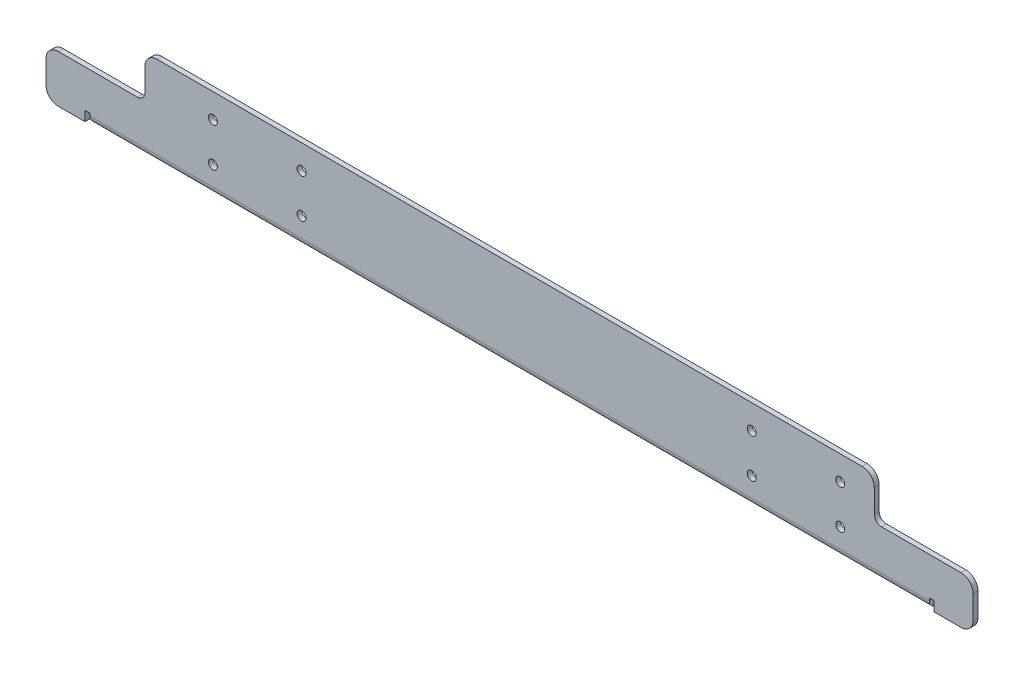
from build123d import *

# Parameters (mm, degrees)
BOSS_EXTRUDE1_START        = 8
SKETCH2_W                  = 381
SKETCH2_H                  = 2
BOSS_EXTRUDE1_DEPTH        = 37
SKETCH3_W                  = 345
SKETCH3_H                  = 2
BOSS_EXTRUDE2_DEPTH        = 6
SKETCH4_W                  = 40.623
SKETCH4_H                  = 17.5
CUT_EXTRUDE1_DEPTH         = 3
F_6_CLEARANCE_HOLE1_D      = 3.6576
FILLET2_R                  = 5
FILLET3_R                  = 3
SKETCH8_W                  = 2
SKETCH8_H                  = 4
CUT_EXTRUDE2_DEPTH         = 196.834751768
FLATTEN_BENDS1_START       = -7
FLATTEN_BENDS1_OUTLINE_W   = 345
FLATTEN_BENDS1_OUTLINE_H   = 2
FLATTEN_BENDS1_DEPTH       = 6
FLATTEN_BENDS1_START_2     = -1
FLATTEN_BENDS1_2_OUTLINE_W = 345
FLATTEN_BENDS1_2_OUTLINE_H = 4.701769682
FLATTEN_BENDS1_2_DEPTH     = 2
PROCESS_BENDS1_START       = -172.5
PROCESS_BENDS1_DEPTH       = 345
PROCESS_BENDS1_2_DEPTH     = 345


# Read off the part's stored shape, not the designer's step: Flatten-Bends1, Process-Bends1
with BuildPart() as part:
    # Sketch2 → Boss-Extrude1 (new body)
    with BuildSketch(Plane(origin=(0, 0, 0), x_dir=(1, 0, 0), z_dir=(0, 1, 0)).offset(BOSS_EXTRUDE1_START)):
        Rectangle(SKETCH2_W, SKETCH2_H)
    extrude(amount=BOSS_EXTRUDE1_DEPTH)

    # Sketch3 → Boss-Extrude2 (add)
    with BuildSketch(Plane(origin=(0, 0, -1), x_dir=(-1, 0, 0), z_dir=(0, 0, -1))):
        with Locations((0, 9)):
            Rectangle(SKETCH3_W, SKETCH3_H)
    extrude(amount=BOSS_EXTRUDE2_DEPTH)

    # Sketch4 → Cut-Extrude1 (cut)
    with BuildSketch(Plane.XY.offset(1)):
        with Locations((170.1885, 36.25)):
            Rectangle(SKETCH4_W, SKETCH4_H)
        with Locations((-170.1885, 36.25)):
            Rectangle(SKETCH4_W, SKETCH4_H)
    extrude(amount=-CUT_EXTRUDE1_DEPTH, mode=Mode.SUBTRACT)

    # #6 Clearance Hole1 (through all)
    with Locations(Plane.XY.offset(1)):
        with Locations((-121.9, 35), (-121.9, 19), (-85.5, 35), (-85.5, 19), (99.5, 19), (99.5, 35), (135.9, 35), (135.9, 19)):
            Hole(F_6_CLEARANCE_HOLE1_D / 2)

    # Fillet2
    fillet2_edges = [part.edges().sort_by_distance(p)[0] for p in [
        (-190.5, 27.5, 0),
        (-149.877, 45, 0),
        (190.5, 27.5, 0),
        (149.877, 45, 0),
        (-190.5, 8, 0),
        (190.5, 8, 0),
    ]]
    fillet(fillet2_edges, radius=FILLET2_R)

    # Fillet3
    fillet3_edges = [part.edges().sort_by_distance(p)[0] for p in [
        (-149.877, 27.5, 0),
        (149.877, 27.5, 0),
    ]]
    fillet(fillet3_edges, radius=FILLET3_R)

    # Sketch8 → Cut-Extrude2 (cut, through all)
    with BuildSketch(Plane(origin=(0, 0, -1), x_dir=(-1, 0, 0), z_dir=(0, 0, -1))):
        with Locations((173.5, 10)):
            Rectangle(SKETCH8_W, SKETCH8_H)
        with Locations((-173.5, 10)):
            Rectangle(SKETCH8_W, SKETCH8_H)
    extrude(amount=-CUT_EXTRUDE2_DEPTH, mode=Mode.SUBTRACT)

    # Flatten-Bends1 outline → Flatten-Bends1 (cut)
    with BuildSketch(Plane.XY.offset(FLATTEN_BENDS1_START)):
        with Locations((0, 9)):
            Rectangle(FLATTEN_BENDS1_OUTLINE_W, FLATTEN_BENDS1_OUTLINE_H)
    extrude(amount=FLATTEN_BENDS1_DEPTH, mode=Mode.SUBTRACT)

    # Flatten-Bends1 2 outline → Flatten-Bends1 2 (add)
    with BuildSketch(Plane.XY.offset(FLATTEN_BENDS1_START_2)):
        with Locations((0, 5.649115159)):
            Rectangle(FLATTEN_BENDS1_2_OUTLINE_W, FLATTEN_BENDS1_2_OUTLINE_H)
    extrude(amount=FLATTEN_BENDS1_2_DEPTH)

    # Process-Bends1 outline → Process-Bends1 (cut)
    with BuildSketch(Plane.YZ.offset(PROCESS_BENDS1_START)):
        with BuildLine():
            Line((3.298230318, -1), (8.171572875, -1))
            ThreePointArc((8.171572875, -1), (9.267949192, 0.449489743), (11, 1))
            Line((11, 1), (3.298230318, 1))
            Line((3.298230318, 1), (3.298230318, -1))
        make_face()
    extrude(amount=PROCESS_BENDS1_DEPTH, mode=Mode.SUBTRACT)

    # Process-Bends1 2 outline → Process-Bends1 2 (add)
    with BuildSketch(Plane.YZ.offset(PROCESS_BENDS1_START)):
        with BuildLine():
            Line((8, -2), (8, -7))
            Line((8, -7), (10, -7))
            Line((10, -7), (10, -2))
            ThreePointArc((10, -2), (10.292893219, -1.292893219), (11, -1))
            Line((11, -1), (8.171572875, -1))
            ThreePointArc((8.171572875, -1), (8.043204321, -1.492694064), (8, -2))
        make_face()
    extrude(amount=PROCESS_BENDS1_2_DEPTH)


solid = part.part
